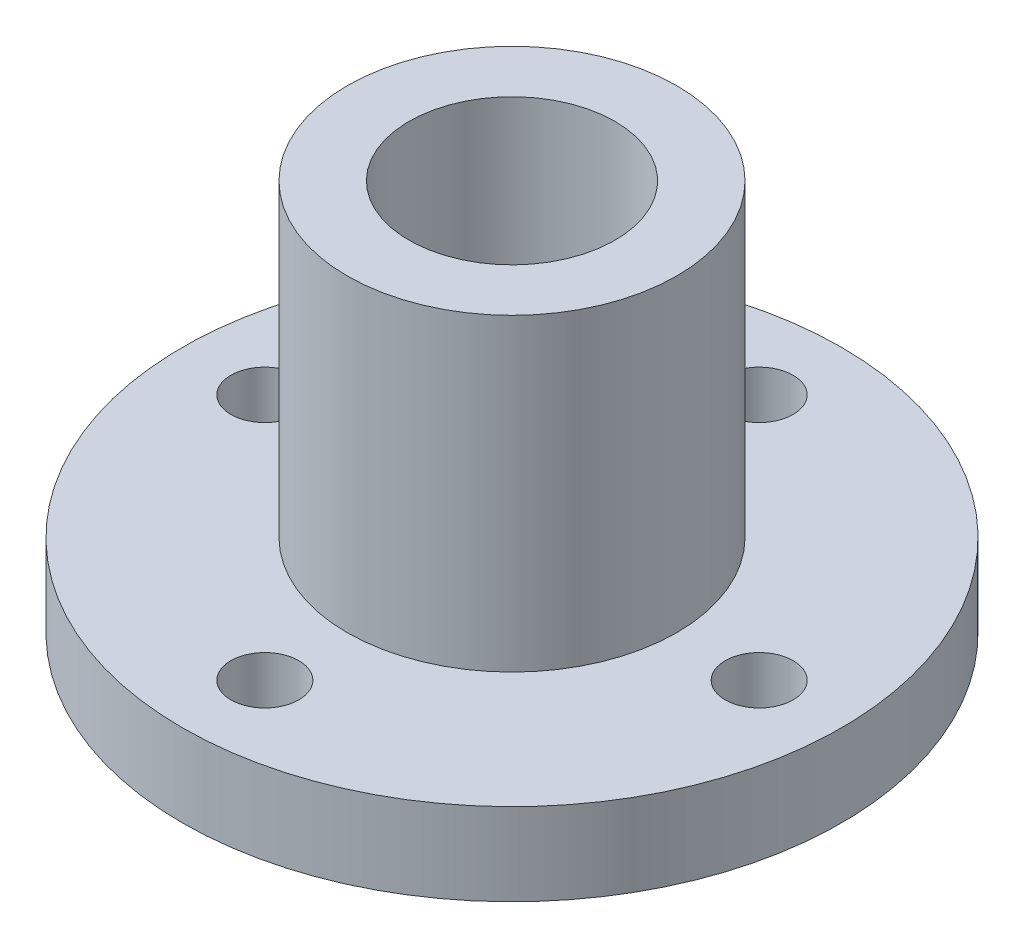
from build123d import *

# Parameters (mm, degrees)
F_3_3_3_3_DIAMETER_HOLE1_D = 3.3


with BuildPart() as part:
    # Sketch1 → Revolve1 (revolve)
    with BuildSketch(Plane.XY):
        Polygon((-5, 0), (-5, 19), (-8, 19), (-8, 4), (-16, 4), (-16, 0), align=None)
    revolve(axis=Axis((0, 0, 0), (0, 1, 0)))

    # Ø3.3 (3.3) Diameter Hole1 (through all)
    with Locations(Plane(origin=(0, 0, 0), x_dir=(-1, 0, 0), z_dir=(0, -1, 0))):
        with Locations((-12, 0), (0, 12), (12, 0), (0, -12)):
            Hole(F_3_3_3_3_DIAMETER_HOLE1_D / 2)


solid = part.part
